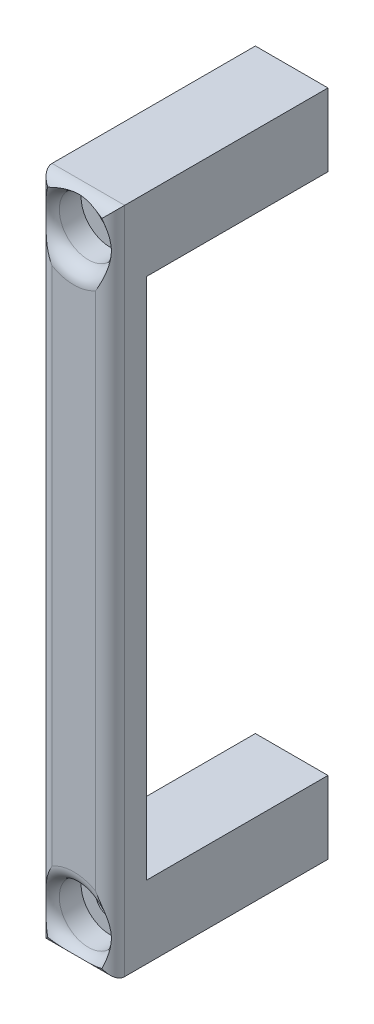
from build123d import *
from build123d.topology import SkipClean

# Parameters (mm, degrees)
SCHIZZO1_W                   = 10
SCHIZZO1_H                   = 10
SCHIZZO1_R                   = 2
ESTRUSIONE_ESTRUSIONE1_DEPTH = 25
SCHIZZO2_W                   = 10
SCHIZZO2_H                   = 92
SCHIZZO2_R                   = 1.75
SCHIZZO2_R_2                 = 2
ESTRUSIONE_ESTRUSIONE2_DEPTH = 5
ESTRUSIONE_ESTRUSIONE3_START = 25
SCHIZZO3_W                   = 10
SCHIZZO3_H                   = 10
SCHIZZO3_R                   = 1.75
ESTRUSIONE_ESTRUSIONE3_DEPTH = 25
SCHIZZO4_R                   = 4
TAGLIO_ESTRUSIONE1_DEPTH     = 5
RACCORDO1_R                  = 2


with BuildPart() as part:
    # Schizzo1 → Estrusione-Estrusione1 (new body)
    with BuildSketch(Plane.XY):
        Rectangle(SCHIZZO1_W, SCHIZZO1_H)
        Circle(SCHIZZO1_R, mode=Mode.SUBTRACT)
    extrude(amount=ESTRUSIONE_ESTRUSIONE1_DEPTH)

    # Schizzo2 → Estrusione-Estrusione2 (add)
    with BuildSketch(Plane.XY.offset(25)):
        with Locations((0, 41)):
            Rectangle(SCHIZZO2_W, SCHIZZO2_H)
        with Locations((0, 82)):
            Circle(SCHIZZO2_R, mode=Mode.SUBTRACT)
        Circle(SCHIZZO2_R_2, mode=Mode.SUBTRACT)
    extrude(amount=ESTRUSIONE_ESTRUSIONE2_DEPTH)

    # Schizzo3 → Estrusione-Estrusione3 (add)
    with SkipClean():  # the faces are left unmerged after this step: merging them gives an invalid solid
        with BuildSketch(Plane(origin=(0, 0, 25), x_dir=(-1, 0, 0), z_dir=(0, 0, -1)).offset(ESTRUSIONE_ESTRUSIONE3_START)):
            with Locations((0, 82)):
                Rectangle(SCHIZZO3_W, SCHIZZO3_H)
            with Locations((0, 82)):
                Circle(SCHIZZO3_R, mode=Mode.SUBTRACT)
        extrude(amount=-ESTRUSIONE_ESTRUSIONE3_DEPTH)

    # Schizzo4 → Taglio-Estrusione1 (cut)
    with BuildSketch(Plane.XY.offset(30)):
        Circle(SCHIZZO4_R)
        with Locations((0, 82)):
            Circle(SCHIZZO4_R)
    extrude(amount=-TAGLIO_ESTRUSIONE1_DEPTH, mode=Mode.SUBTRACT)

    # Raccordo1
    # the kernel refuses this fillet: 2 mm, written as the material it takes off along each edge
    with BuildSketch(Plane(origin=(-5, 92, 30), x_dir=(1, 0, 0), z_dir=(0, -1, 0)), Plane(origin=(5, -10, 30), x_dir=(-1, 0, 0), z_dir=(0, 1, 0))) as raccordo1_piece_1:
        with BuildLine():
            CenterArc((RACCORDO1_R, -RACCORDO1_R), RACCORDO1_R, 90, 90)
            Line((0, -RACCORDO1_R), (0, 0))
            Line((0, 0), (RACCORDO1_R, 0))
        make_face()
    extrude(amount=102, mode=Mode.SUBTRACT)
    with BuildSketch(Plane(origin=(-10, -5, 30), x_dir=(0, 1, 0), z_dir=(1, 0, 0)), Plane(origin=(10, 87, 30), x_dir=(0, -1, 0), z_dir=(-1, 0, 0))) as raccordo1_piece_2:
        with BuildLine():
            CenterArc((RACCORDO1_R, -RACCORDO1_R), RACCORDO1_R, 90, 90)
            Line((0, -RACCORDO1_R), (0, 0))
            Line((0, 0), (RACCORDO1_R, 0))
        make_face()
    extrude(amount=20, mode=Mode.SUBTRACT)
    with BuildSketch(Plane(origin=(0, 0, 30), x_dir=(1, 0, 0), z_dir=(0, -1, 0))) as raccordo1_piece_3:
        with BuildLine():
            CenterArc((4 + RACCORDO1_R, -RACCORDO1_R), RACCORDO1_R, 90, 90)
            Line((4, -RACCORDO1_R), (4, 0))
            Line((4, 0), (4 + RACCORDO1_R, 0))
        make_face()
    revolve(axis=Axis((0, 0, 30), (0, 0, 1)), mode=Mode.SUBTRACT)
    with BuildSketch(Plane(origin=(0, 82, 30), x_dir=(1, 0, 0), z_dir=(0, -1, 0))) as raccordo1_piece_4:
        with BuildLine():
            CenterArc((4 + RACCORDO1_R, -RACCORDO1_R), RACCORDO1_R, 90, 90)
            Line((4 + RACCORDO1_R, 0), (4, 0))
            Line((4, 0), (4, -RACCORDO1_R))
        make_face()
    revolve(axis=Axis((0, 82, 30), (0, 0, 1)), mode=Mode.SUBTRACT)


solid = part.part
